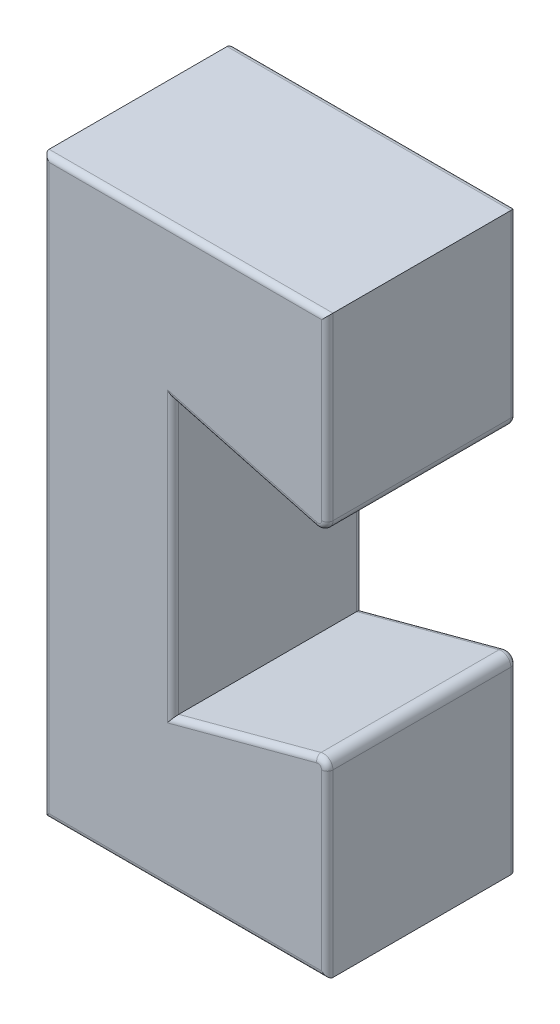
from build123d import *

# Parameters (mm, degrees)
BOSS_EXTRU_1_DEPTH = 10
CONG_1_R           = 0.3
CONG_2_R           = 0.5


with BuildPart() as part:
    # Esquisse1 → Boss.-Extru.1 (new body)
    with BuildSketch(Plane.XY):
        Polygon((15, 20.25), (6.85, 22.433785918), (6.85, 7.966214082), (15, 10.15), (15, 0), (0, 0), (0, 30.4), (15, 30.4), align=None)
    extrude(amount=BOSS_EXTRU_1_DEPTH)

    # Congé1
    cong_1_edges = [part.edges().sort_by_distance(p)[0] for p in [
        (10.925, 9.058107041, 0),
        (15, 5.075, 0),
        (7.5, 0, 0),
        (0, 15.2, 0),
        (15, 5.075, 10),
        (10.925, 9.058107041, 10),
        (6.85, 15.2, 10),
        (10.925, 21.341892959, 10),
        (15, 25.325, 10),
        (7.5, 30.4, 10),
        (0, 15.2, 10),
        (7.5, 30.4, 0),
        (7.5, 0, 10),
        (15, 25.325, 0),
        (10.925, 21.341892959, 0),
        (6.85, 15.2, 0),
    ]]
    fillet(cong_1_edges, radius=CONG_1_R)

    # Congé2
    # the kernel refuses this fillet: 0.5 mm, written as the material it takes off along each edge
    with BuildSketch(Plane(origin=(14.5, 20.901612686, 0), x_dir=(1, 0, 0), z_dir=(0, 1, 0))) as cong_2_piece_1:
        with BuildLine():
            CenterArc((0.2, -0.3), 0.3, 0, 90)
            Line((0.5, -0.3), (0.5, 0))
            Line((0.5, 0), (0.2, 0))
        make_face()
    revolve(axis=Axis((14.5, 20.901612686, 0), (0, 0, -1)), revolution_arc=105, mode=Mode.SUBTRACT)
    with BuildSketch(Plane(origin=(14.5, 9.498387314, 0), x_dir=(-0.2588190451025178, 0.9659258262890691, 0), z_dir=(-0.9659258262890691, -0.2588190451025178, 0))) as cong_2_piece_2:
        with BuildLine():
            CenterArc((0.2, -0.3), 0.3, 0, 90)
            Line((0.5, -0.3), (0.5, 0))
            Line((0.5, 0), (0.2, 0))
        make_face()
    revolve(axis=Axis((14.5, 9.498387314, 0), (0, 0, -1)), revolution_arc=105, mode=Mode.SUBTRACT)
    with BuildSketch(Plane(origin=(14.5, 9.498387314, 10), x_dir=(1, 0, 0), z_dir=(0, -1, 0))) as cong_2_piece_3:
        with BuildLine():
            CenterArc((0.2, -0.3), 0.3, 0, 90)
            Line((0.5, -0.3), (0.5, 0))
            Line((0.5, 0), (0.2, 0))
        make_face()
    revolve(axis=Axis((14.5, 9.498387314, 10), (0, 0, 1)), revolution_arc=105, mode=Mode.SUBTRACT)
    with BuildSketch(Plane(origin=(14.5, 20.901612686, 10), x_dir=(-0.2588190451025179, -0.9659258262890691, 0), z_dir=(-0.9659258262890691, 0.2588190451025179, 0))) as cong_2_piece_4:
        with BuildLine():
            CenterArc((0.2, -0.3), 0.3, 0, 90)
            Line((0.5, -0.3), (0.5, 0))
            Line((0.5, 0), (0.2, 0))
        make_face()
    revolve(axis=Axis((14.5, 20.901612686, 10), (0, 0, 1)), revolution_arc=105, mode=Mode.SUBTRACT)
    with BuildSketch(Plane(origin=(15, 10.15, 0), x_dir=(-0.9659258262890693, -0.25881904510251724, 0), z_dir=(0, 0, 1))) as cong_2_piece_5:
        with BuildLine():
            CenterArc((CONG_2_R * 1.30322537284, CONG_2_R), CONG_2_R, 165, 105)
            Line((CONG_2_R * 0.337299546552, CONG_2_R * 1.2588190451), (0, 0))
            Line((0, 0), (CONG_2_R * 1.30322537284, 0))
        make_face()
    extrude(amount=10, mode=Mode.SUBTRACT)
    with BuildSketch(Plane(origin=(15, 20.25, 0), x_dir=(-0.9659258262890691, 0.2588190451025179, 0), z_dir=(0, 0, 1))) as cong_2_piece_6:
        with BuildLine():
            CenterArc((CONG_2_R * 1.30322537284, -CONG_2_R), CONG_2_R, 90, 105)
            Line((CONG_2_R * 0.337299546552, -CONG_2_R * 1.2588190451), (0, 0))
            Line((0, 0), (CONG_2_R * 1.30322537284, 0))
        make_face()
    extrude(amount=10, mode=Mode.SUBTRACT)


solid = part.part
